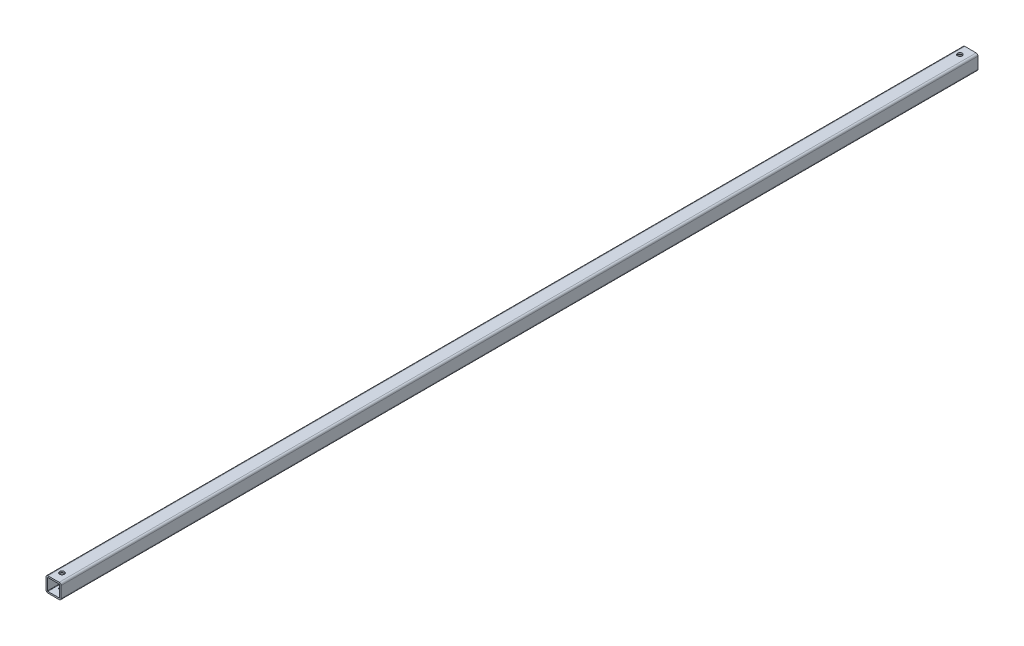
from build123d import *

# Parameters (mm, degrees)
EXTRUDE_THIN1_DEPTH             = 609.6
F_1_4_0_25_DIAMETER_HOLE1_D     = 6.35
F_1_4_0_25_DIAMETER_HOLE1_DEPTH = 25.4
F_1_4_0_25_DIAMETER_HOLE1_TIP   = 1.907732465
F_1_4_0_25_DIAMETER_HOLE2_D     = 6.35
F_1_4_0_25_DIAMETER_HOLE2_DEPTH = 25.4
F_1_4_0_25_DIAMETER_HOLE2_TIP   = 1.907732465


with BuildPart() as part:
    # Sketch1 → Extrude-Thin1 (new, symmetric)
    with BuildSketch(Plane.XY):
        with BuildLine():
            Line((-10, -7.5), (-10, 7.5))
            ThreePointArc((-10, 7.5), (-9.267766953, 9.267766953), (-7.5, 10))
            Line((-7.5, 10), (7.5, 10))
            ThreePointArc((7.5, 10), (9.267766953, 9.267766953), (10, 7.5))
            Line((10, 7.5), (10, -7.5))
            ThreePointArc((10, -7.5), (9.267766953, -9.267766953), (7.5, -10))
            Line((7.5, -10), (-7.5, -10))
            ThreePointArc((-7.5, -10), (-9.267766953, -9.267766953), (-10, -7.5))
        make_face()
        with BuildLine():
            Line((-8, -7.5), (-8, 7.5))
            ThreePointArc((-8, 7.5), (-7.853553391, 7.853553391), (-7.5, 8))
            Line((-7.5, 8), (7.5, 8))
            ThreePointArc((7.5, 8), (7.853553391, 7.853553391), (8, 7.5))
            Line((8, 7.5), (8, -7.5))
            ThreePointArc((8, -7.5), (7.853553391, -7.853553391), (7.5, -8))
            Line((7.5, -8), (-7.5, -8))
            ThreePointArc((-7.5, -8), (-7.853553391, -7.853553391), (-8, -7.5))
        make_face(mode=Mode.SUBTRACT)
    extrude(amount=EXTRUDE_THIN1_DEPTH, both=True)

    # 1/4 (0.25) Diameter Hole1
    with Locations(Plane(origin=(0, 10, 0), x_dir=(1, 0, 0), z_dir=(0, 1, 0))):
        with Locations((-1.399162535, 596.9)):
            Hole(F_1_4_0_25_DIAMETER_HOLE1_D / 2, depth=F_1_4_0_25_DIAMETER_HOLE1_DEPTH)
            with Locations((0, 0, -(F_1_4_0_25_DIAMETER_HOLE1_DEPTH + F_1_4_0_25_DIAMETER_HOLE1_TIP / 2))):  # 118° drill point
                Cone(0, F_1_4_0_25_DIAMETER_HOLE1_D / 2, F_1_4_0_25_DIAMETER_HOLE1_TIP, mode=Mode.SUBTRACT)

    # 1/4 (0.25) Diameter Hole2
    with Locations(Plane(origin=(0, 10, 0), x_dir=(1, 0, 0), z_dir=(0, 1, 0))):
        with Locations((-1.399162535, -596.9)):
            Hole(F_1_4_0_25_DIAMETER_HOLE2_D / 2, depth=F_1_4_0_25_DIAMETER_HOLE2_DEPTH)
            with Locations((0, 0, -(F_1_4_0_25_DIAMETER_HOLE2_DEPTH + F_1_4_0_25_DIAMETER_HOLE2_TIP / 2))):  # 118° drill point
                Cone(0, F_1_4_0_25_DIAMETER_HOLE2_D / 2, F_1_4_0_25_DIAMETER_HOLE2_TIP, mode=Mode.SUBTRACT)


solid = part.part
